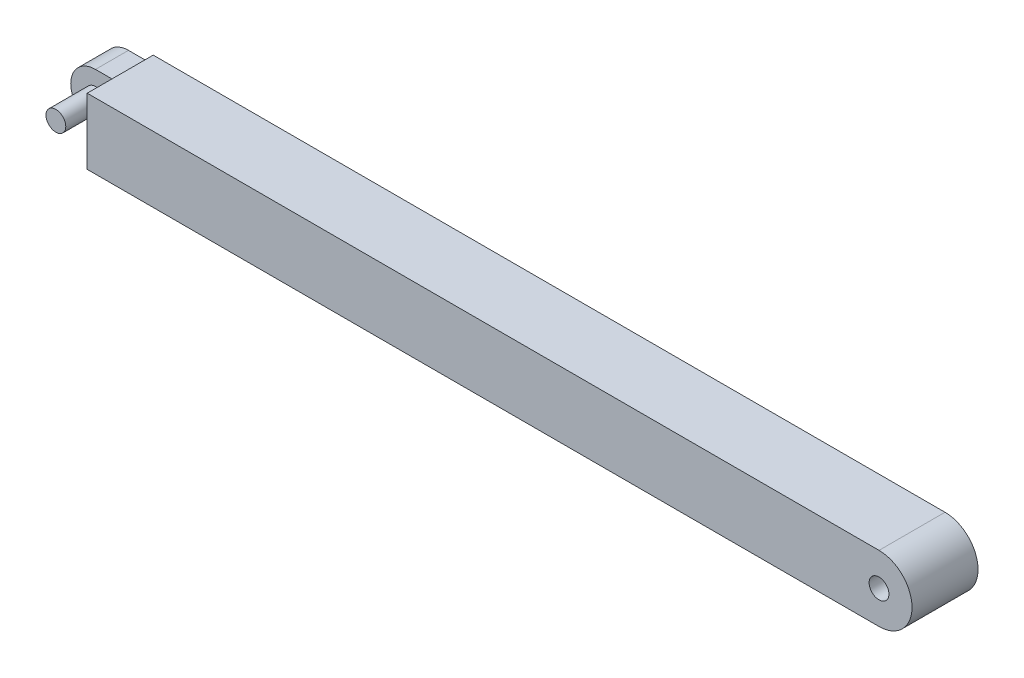
from build123d import *

# Parameters (mm, degrees)
BOSS_EXTRUDE3_DEPTH = 4.233333333
SKETCH4_W           = 2.116666667
SKETCH4_H           = 3.175
BOSS_EXTRUDE5_DEPTH = 3.175
CUT_EXTRUDE1_START  = -2.116666667
CUT_EXTRUDE1_DEPTH  = 2.116666667
SKETCH6_R           = 0.635
BOSS_EXTRUDE6_DEPTH = 2.54
SKETCH7_R           = 0.635
CUT_EXTRUDE2_DEPTH  = 1.27
CUT_EXTRUDE3_START  = -1.27
SKETCH8_R           = 0.635
CUT_EXTRUDE3_DEPTH  = 1.27


# Read off the part's stored shape, not the designer's step: Cut-Extrude1
with BuildPart() as part:
    # Sketch3 → Boss-Extrude3 (new body)
    with BuildSketch(Plane.XY):
        with BuildLine():
            Line((0, 0), (50.8, 0))
            ThreePointArc((50.8, 0), (52.916666667, -2.116666667), (50.8, -4.233333333))
            Line((50.8, -4.233333333), (0, -4.233333333))
            Line((0, -4.233333333), (0, 0))
        make_face()
    extrude(amount=BOSS_EXTRUDE3_DEPTH)

    # Sketch4 → Boss-Extrude5 (add)
    with BuildSketch(Plane.ZY):
        with Locations((1.058333334, -2.116666667)):
            Rectangle(SKETCH4_W, SKETCH4_H)
    extrude(amount=BOSS_EXTRUDE5_DEPTH)

    # Cut-Extrude1 outline → Cut-Extrude1 (cut)
    with BuildSketch(Plane(origin=(0, 0, 0), x_dir=(-1, 0, 0), z_dir=(0, 0, -1)).offset(CUT_EXTRUDE1_START)):
        with BuildLine():
            Line((3.175, -0.529166667), (1.5875, -0.529166667))
            ThreePointArc((1.5875, -0.529166667), (2.710032015, -0.994134652), (3.175, -2.116666667))
            Line((3.175, -2.116666667), (3.175, -0.529166667))
        make_face()
        with BuildLine():
            Line((3.175, -3.704166667), (3.175, -2.116666667))
            ThreePointArc((3.175, -2.116666667), (2.710032015, -3.239198682), (1.5875, -3.704166667))
            Line((1.5875, -3.704166667), (3.175, -3.704166667))
        make_face()
    extrude(amount=CUT_EXTRUDE1_DEPTH, mode=Mode.SUBTRACT)

    # Sketch6 → Boss-Extrude6 (add)
    with BuildSketch(Plane.XY.offset(2.116666667)):
        with Locations(Location((-1.5875, -2.116666667, 0), (0, 0, 90))):
            Circle(SKETCH6_R)
    extrude(amount=BOSS_EXTRUDE6_DEPTH)

    # Sketch7 → Cut-Extrude2 (cut)
    with BuildSketch(Plane.XY.offset(4.233333333)):
        with Locations((50.8, -2.116666667)):
            Circle(SKETCH7_R)
    extrude(amount=-CUT_EXTRUDE2_DEPTH, mode=Mode.SUBTRACT)

    # Sketch8 → Cut-Extrude3 (cut)
    with BuildSketch(Plane(origin=(0, 0, 0), x_dir=(-1, 0, 0), z_dir=(0, 0, -1)).offset(CUT_EXTRUDE3_START)):
        with Locations(Location((-50.8, -2.116666667, 0), (0, 0, 180))):
            Circle(SKETCH8_R)
    extrude(amount=CUT_EXTRUDE3_DEPTH, mode=Mode.SUBTRACT)


solid = part.part
